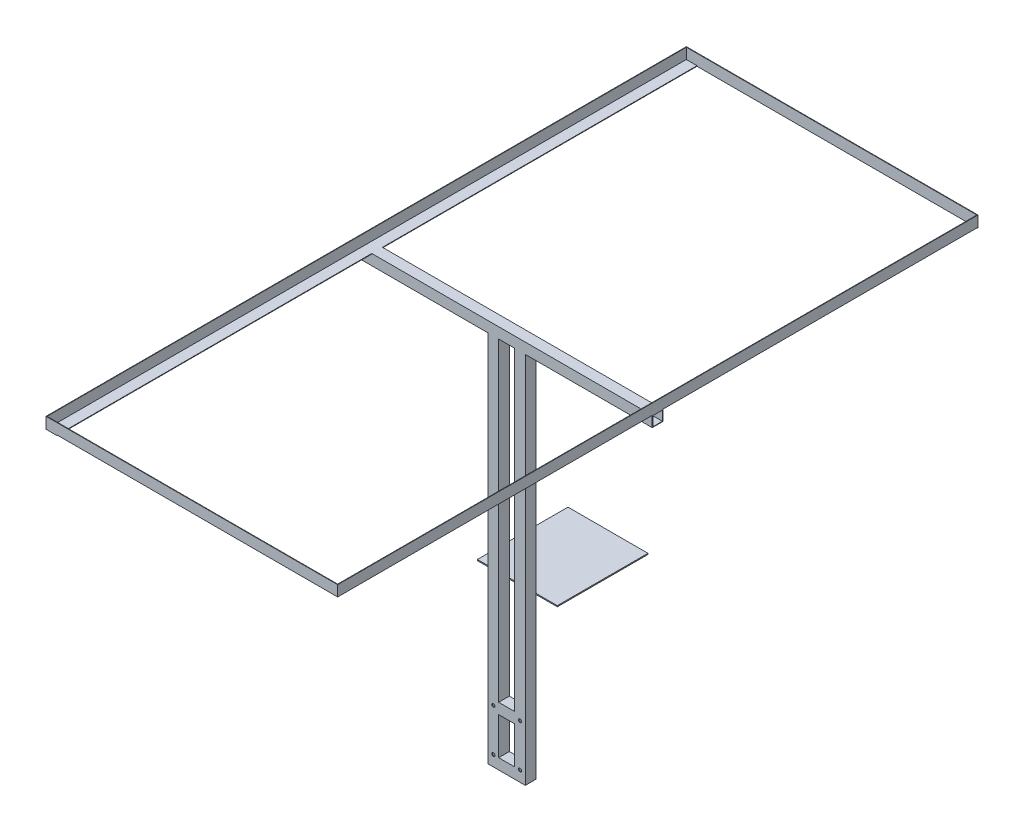
from build123d import *

# Parameters (mm, degrees)
SKETCH1_W                = 20
SKETCH1_H                = 20
SKETCH1_W_2              = 18
SKETCH1_H_2              = 18
EXTRUDE_THIN1_DEPTH      = 700
EXTRUDE_THIN1_2_DEPTH    = 700
EXTRUDE_THIN2_DEPTH      = 238
EXTRUDE_THIN2_DEPTH_BACK = 308
SKETCH3_W                = 20
SKETCH3_H                = 20
SKETCH3_W_2              = 18
SKETCH3_H_2              = 18
F_6_0MM_DOWEL_HOLE1_D    = 6
EXTRUDE_THIN3_DEPTH      = 590
EXTRUDE_THIN3_DEPTH_BACK = 610
SKETCH8_W                = 547
SKETCH8_H                = 21
BOSS_EXTRUDE1_DEPTH      = 1
SKETCH9_W                = 547
SKETCH9_H                = 20
BOSS_EXTRUDE4_DEPTH      = 1
SKETCH10_W               = 20
SKETCH10_H               = 20
BOSS_EXTRUDE5_DEPTH      = 30
SKETCH11_W               = 150
SKETCH11_H               = 2
BOSS_EXTRUDE6_DEPTH      = 170


with BuildPart() as part:
    # Sketch1 → Extrude-Thin1 (new body)
    with BuildSketch(Plane(origin=(0, 0, 0), x_dir=(1, 0, 0), z_dir=(0, 1, 0))):
        with Locations((10, -10)):
            Rectangle(SKETCH1_W, SKETCH1_H)
        with Locations((10, -10)):
            Rectangle(SKETCH1_W_2, SKETCH1_H_2, mode=Mode.SUBTRACT)
    extrude(amount=EXTRUDE_THIN1_DEPTH)



with BuildPart() as body_2:
    # Sketch1 → Extrude-Thin1 2 (new body)
    with BuildSketch(Plane(origin=(0, 0, 0), x_dir=(1, 0, 0), z_dir=(0, 1, 0))):
        with Locations((-40, -10)):
            Rectangle(SKETCH1_W, SKETCH1_H)
        with Locations((-40, -10)):
            Rectangle(SKETCH1_W_2, SKETCH1_H_2, mode=Mode.SUBTRACT)
    extrude(amount=EXTRUDE_THIN1_2_DEPTH)


with BuildPart() as part_1:
    add(part.part)

    add(body_2.part)  # Extrude-Thin2 merges body 2
    # Sketch3 → Extrude-Thin2 (add, two sides: drawn at the far end of the back side and taken through both)
    with BuildSketch(Plane(origin=(20, 0, 0), x_dir=(0, 0, -1), z_dir=(1, 0, 0)).offset(-EXTRUDE_THIN2_DEPTH_BACK)):
        with Locations((-10, 710)):
            Rectangle(SKETCH3_W, SKETCH3_H)
        with Locations((-10, 710)):
            Rectangle(SKETCH3_W_2, SKETCH3_H_2, mode=Mode.SUBTRACT)
    extrude(amount=EXTRUDE_THIN2_DEPTH + EXTRUDE_THIN2_DEPTH_BACK)

    # Ø6.0mm Dowel Hole1 (through all)
    with Locations(Plane(origin=(0, 0, 0), x_dir=(-1, 0, 0), z_dir=(0, 0, -1))):
        with Locations((40, 20), (-10, 20), (-10, 100), (40, 100)):
            Hole(F_6_0MM_DOWEL_HOLE1_D / 2)

    # Sketch6 → Extrude-Thin3 (add, two sides: drawn at the far end of the back side and taken through both)
    with BuildSketch(Plane(origin=(0, 0, 0), x_dir=(-1, 0, 0), z_dir=(0, 0, -1)).offset(-EXTRUDE_THIN3_DEPTH_BACK)):
        Polygon((-238, 720), (-258, 720), (-258, 740), (-257, 740), (-257, 721), (-238, 721), align=None)
        Polygon((268, 720), (288, 720), (288, 740), (289, 740), (289, 719), (268, 719), align=None)
    extrude(amount=EXTRUDE_THIN3_DEPTH + EXTRUDE_THIN3_DEPTH_BACK)

    # Sketch8 → Boss-Extrude1 (add)
    with BuildSketch(Plane(origin=(0, 0, -590), x_dir=(-1, 0, 0), z_dir=(0, 0, -1))):
        with Locations((15.5, 729.5)):
            Rectangle(SKETCH8_W, SKETCH8_H)
    extrude(amount=BOSS_EXTRUDE1_DEPTH)

    # Sketch9 → Boss-Extrude4 (add)
    with BuildSketch(Plane.XY.offset(610)):
        with Locations((-15.5, 730)):
            Rectangle(SKETCH9_W, SKETCH9_H)
    extrude(amount=-BOSS_EXTRUDE4_DEPTH)

    # Sketch10 → Boss-Extrude5 (add)
    with BuildSketch(Plane(origin=(-30, 0, 0), x_dir=(0, 0, -1), z_dir=(1, 0, 0))):
        with Locations((-10, 10)):
            Rectangle(SKETCH10_W, SKETCH10_H)
        with Locations((-10, 100)):
            Rectangle(SKETCH10_W, SKETCH10_H)
    extrude(amount=BOSS_EXTRUDE5_DEPTH)

    # Sketch11 → Boss-Extrude6 (add)
    with BuildSketch(Plane(origin=(0, 0, 0), x_dir=(-1, 0, 0), z_dir=(0, 0, -1))):
        with Locations((15, 301)):
            Rectangle(SKETCH11_W, SKETCH11_H)
    extrude(amount=BOSS_EXTRUDE6_DEPTH)


solid = part_1.part
